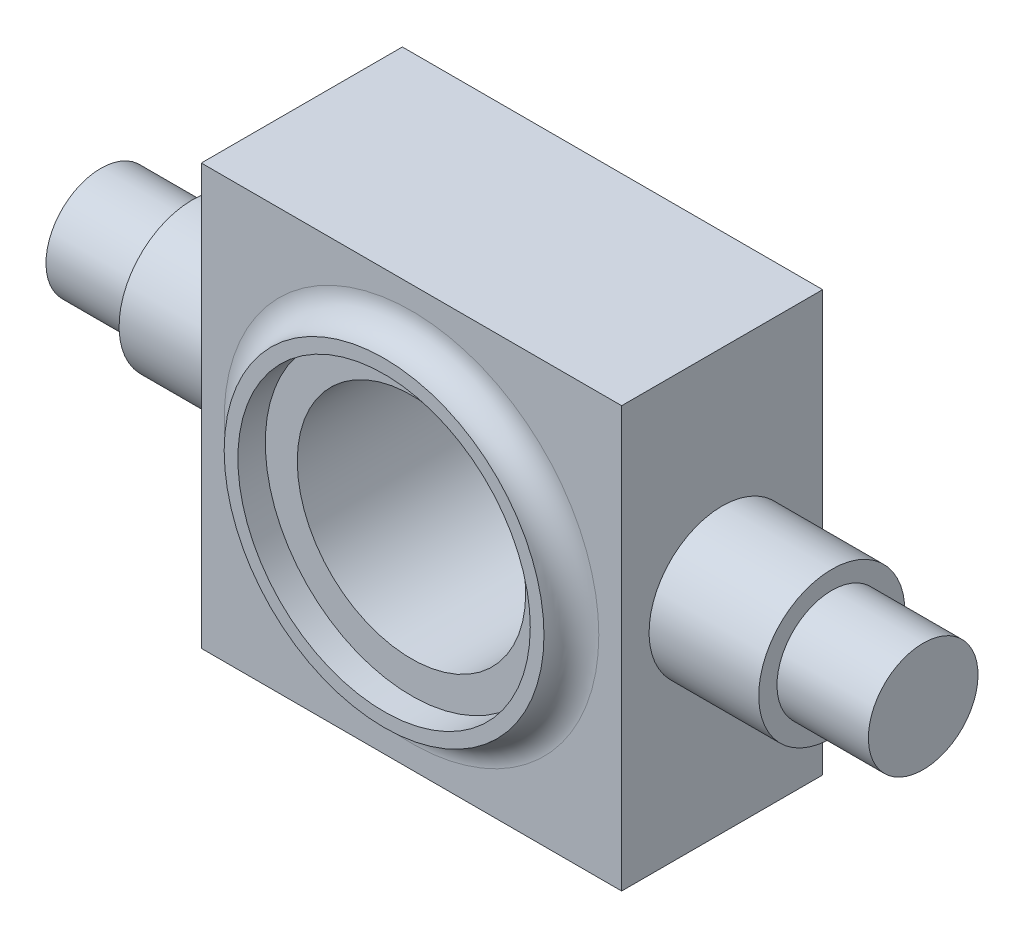
from build123d import *

# Parameters (mm, degrees)
SKETCH1_W           = 46
SKETCH1_H           = 46
BOSS_EXTRUDE3_DEPTH = 11
SKETCH3_R           = 17.5
SKETCH3_R_2         = 16
BOSS_EXTRUDE5_DEPTH = 3
SKETCH6_R           = 12.5
CUT_EXTRUDE2_DEPTH  = 40.268307832
FILLET1_R           = 3


with BuildPart() as part:
    # Sketch1 → Boss-Extrude3 (new, symmetric)
    with BuildSketch(Plane.XY):
        Rectangle(SKETCH1_W, SKETCH1_H)
    extrude(amount=BOSS_EXTRUDE3_DEPTH, both=True)

    # Sketch3 → Boss-Extrude5 (add)
    with BuildSketch(Plane.XY.offset(11)):
        Circle(SKETCH3_R)
        Circle(SKETCH3_R_2, mode=Mode.SUBTRACT)
    boss_extrude5 = extrude(amount=BOSS_EXTRUDE5_DEPTH)

    # Sketch6 → Cut-Extrude2 (cut, through all)
    with BuildSketch(Plane.XY.offset(11)):
        Circle(SKETCH6_R)
    extrude(amount=-CUT_EXTRUDE2_DEPTH, mode=Mode.SUBTRACT)

    # Mirror1: Boss-Extrude5 across plane
    add(boss_extrude5.mirror(Plane.XY))

    # Fillet1
    fillet1_edges = [part.edges().sort_by_distance(p)[0] for p in [
        (-17.5, 0, 11),
        (-17.5, 0, -11),
    ]]
    fillet(fillet1_edges, radius=FILLET1_R - 0.0001)  # a hair under: the kernel refuses the full size

    # Sketch9 → Revolve1 (revolve)
    with BuildSketch(Plane.XY):
        Polygon((-23, 0), (-23, 8), (-35, 8), (-35, 6), (-45, 6), (-45, 0), align=None)
    revolve1 = revolve(axis=Axis((-23, 0, 0), (-1, 0, 0)))

    # Mirror2: Revolve1 across plane
    add(revolve1.mirror(Plane(origin=(0, 0, 0), x_dir=(0, 0, 1), z_dir=(1, 0, 0))))


solid = part.part
